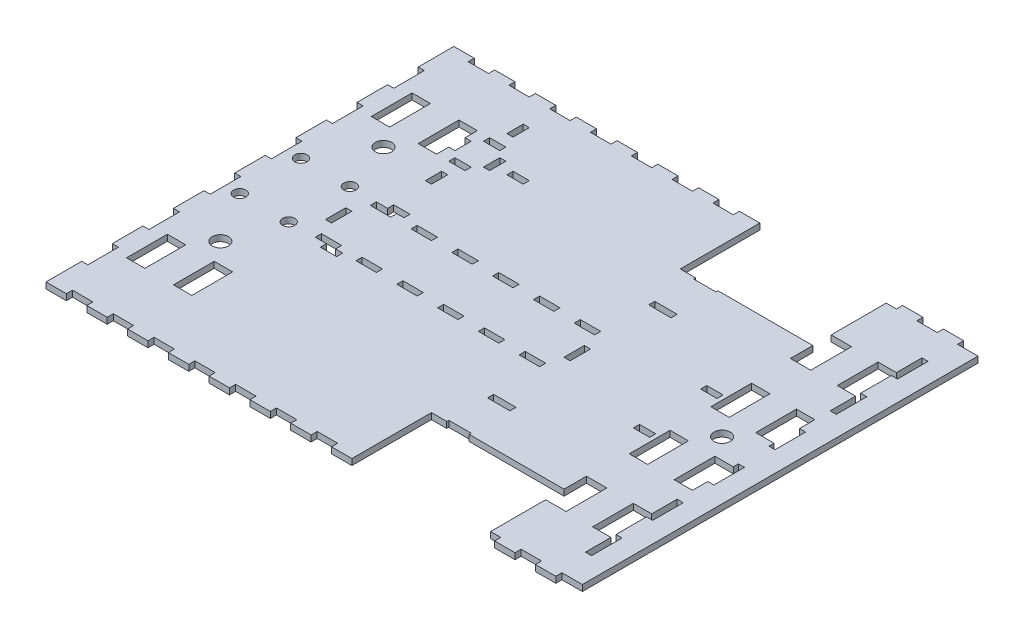
from build123d import *

# Parameters (mm, degrees)
SKETCH3_R             = 3
SKETCH3_W             = 10
SKETCH3_H             = 3
SKETCH3_W_2           = 3
SKETCH3_H_2           = 15
SKETCH3_H_3           = 10
BOSS_EXTRUDE1_DEPTH   = 3
SKETCH5_W             = 11
SKETCH5_H             = 3
CUT_EXTRUDE2_DEPTH    = 10
CROQUIS1_W            = 3
CROQUIS1_H            = 15
CORTAR_EXTRUIR1_DEPTH = 10
CROQUIS2_R            = 4
CROQUIS2_W            = 9
CROQUIS2_H            = 20
CROQUIS2_W_2          = 10
CROQUIS2_W_3          = 8
CROQUIS2_H_2          = 3
CROQUIS2_W_4          = 3
CROQUIS2_H_3          = 8
CORTAR_EXTRUIR2_DEPTH = 10


with BuildPart() as part:
    # Sketch3 → Boss-Extrude1 (new body)
    with BuildSketch(Plane(origin=(0, 0, 0), x_dir=(1, 0, 0), z_dir=(0, 1, 0))):
        Polygon((-300, 97), (-300, -97), (-300, -100), (-290, -100), (-290, -97), (-280, -97), (-280, -100), (-270, -100), (-270, -97), (-260, -97), (-260, -100), (-250, -100), (-250, -97), (-240, -97), (-240, -100), (-230, -100), (-230, -97), (-220, -97), (-220, -100), (-210, -100), (-210, -97), (-200, -97), (-200, -100), (-190, -100), (-190, -97), (-180, -97), (-180, -100), (-170, -100), (-170, -97), (-160, -97), (-160, -100), (-150, -100), (-150, -97), (-140, -97), (-140, -100), (-130, -100), (-130, -97), (-120, -97), (-120, -100), (-110, -100), (-110, -97), (-100, -97), (-100, -100), (-90, -100), (-90, -97), (-80, -97), (-80, -100), (-70, -100), (-70, -97), (-60, -97), (-60, -100), (-50, -100), (-50, -97), (-40, -97), (-40, 97), (-50, 97), (-50, 100), (-60, 100), (-60, 97), (-70, 97), (-70, 100), (-80, 100), (-80, 97), (-90, 97), (-90, 100), (-100, 100), (-100, 97), (-110, 97), (-110, 100), (-120, 100), (-120, 97), (-130, 97), (-130, 100), (-140, 100), (-140, 97), (-150, 97), (-150, 100), (-160, 100), (-160, 97), (-170, 97), (-170, 100), (-180, 100), (-180, 97), (-190, 97), (-190, 100), (-200, 100), (-200, 97), (-210, 97), (-210, 100), (-220, 100), (-220, 97), (-230, 97), (-230, 100), (-240, 100), (-240, 97), (-250, 97), (-250, 100), (-260, 100), (-260, 97), (-270, 97), (-270, 100), (-280, 100), (-280, 97), (-290, 97), (-290, 100), (-300, 100), align=None)
        with Locations((-290, -15)):
            Circle(SKETCH3_R, mode=Mode.SUBTRACT)
        with Locations((-266, -15)):
            Circle(SKETCH3_R, mode=Mode.SUBTRACT)
        with Locations((-248, -13.5)):
            Rectangle(SKETCH3_W, SKETCH3_H, mode=Mode.SUBTRACT)
        Polygon((-255, 5), (-255, 0), (-255, -5), (-258, -5), (-258, 0), (-258, 5), align=None, mode=Mode.SUBTRACT)
        with Locations((-228, -13.5)):
            Rectangle(SKETCH3_W, SKETCH3_H, mode=Mode.SUBTRACT)
        with Locations((-208, -13.5)):
            Rectangle(SKETCH3_W, SKETCH3_H, mode=Mode.SUBTRACT)
        with Locations((-188, -13.5)):
            Rectangle(SKETCH3_W, SKETCH3_H, mode=Mode.SUBTRACT)
        with Locations((-51.5, -75)):
            Rectangle(SKETCH3_W_2, SKETCH3_H_2, mode=Mode.SUBTRACT)
        with Locations((-168, -13.5)):
            Rectangle(SKETCH3_W, SKETCH3_H, mode=Mode.SUBTRACT)
        with Locations((-148, -13.5)):
            Rectangle(SKETCH3_W, SKETCH3_H, mode=Mode.SUBTRACT)
        with Locations((-139.5, 0)):
            Rectangle(SKETCH3_W_2, SKETCH3_H_3, mode=Mode.SUBTRACT)
        with Locations((-51.5, -45)):
            Rectangle(SKETCH3_W_2, SKETCH3_H_2, mode=Mode.SUBTRACT)
        with Locations((-51.5, -15)):
            Rectangle(SKETCH3_W_2, SKETCH3_H_2, mode=Mode.SUBTRACT)
        with Locations((-290, 15)):
            Circle(SKETCH3_R, mode=Mode.SUBTRACT)
        with Locations((-266, 15)):
            Circle(SKETCH3_R, mode=Mode.SUBTRACT)
        with Locations((-248, 13.5)):
            Rectangle(SKETCH3_W, SKETCH3_H, mode=Mode.SUBTRACT)
        with Locations((-228, 13.5)):
            Rectangle(SKETCH3_W, SKETCH3_H, mode=Mode.SUBTRACT)
        with Locations((-208, 13.5)):
            Rectangle(SKETCH3_W, SKETCH3_H, mode=Mode.SUBTRACT)
        with Locations((-188, 13.5)):
            Rectangle(SKETCH3_W, SKETCH3_H, mode=Mode.SUBTRACT)
        with Locations((-168, 13.5)):
            Rectangle(SKETCH3_W, SKETCH3_H, mode=Mode.SUBTRACT)
        with Locations((-148, 13.5)):
            Rectangle(SKETCH3_W, SKETCH3_H, mode=Mode.SUBTRACT)
        with Locations((-51.5, 15)):
            Rectangle(SKETCH3_W_2, SKETCH3_H_2, mode=Mode.SUBTRACT)
        with Locations((-51.5, 45)):
            Rectangle(SKETCH3_W_2, SKETCH3_H_2, mode=Mode.SUBTRACT)
        with Locations((-51.5, 75)):
            Rectangle(SKETCH3_W_2, SKETCH3_H_2, mode=Mode.SUBTRACT)
    extrude(amount=BOSS_EXTRUDE1_DEPTH)

    # Sketch5 → Cut-Extrude2 (cut)
    with BuildSketch(Plane(origin=(0, 3, 0), x_dir=(1, 0, 0), z_dir=(0, 1, 0))):
        with Locations((-137, -39.5)):
            Rectangle(SKETCH5_W, SKETCH5_H)
        Polygon((-131.5, -60), (-142.5, -60), (-142.5, -61), (-150, -61), (-150, -97), (-85, -97), (-85, -61), (-131.5, -61), align=None)
        Polygon((-131.5, 61), (-85, 61), (-85, 97), (-150, 97), (-150, 61), (-142.5, 61), (-142.5, 60), (-131.5, 60), align=None)
        with Locations((-137, 39.5)):
            Rectangle(SKETCH5_W, SKETCH5_H)
    extrude(amount=-CUT_EXTRUDE2_DEPTH, mode=Mode.SUBTRACT)


with BuildPart() as cut_extrude2_kept_piece:
    # of the separate pieces the step leaves, the one the design keeps (cut_extrude2_pieces_kept)
    add(part.part.solids().sort_by_distance((-300, 0, -100))[0])

    # Croquis1 → Cortar-Extruir1 (cut)
    with BuildSketch(Plane(origin=(0, 3, 0), x_dir=(1, 0, 0), z_dir=(0, 1, 0))):
        with Locations((-298.5, -75)):
            Rectangle(CROQUIS1_W, CROQUIS1_H)
        with Locations((-298.5, 45)):
            Rectangle(CROQUIS1_W, CROQUIS1_H)
        with Locations((-298.5, 15)):
            Rectangle(CROQUIS1_W, CROQUIS1_H)
        with Locations((-298.5, -15)):
            Rectangle(CROQUIS1_W, CROQUIS1_H)
        with Locations((-298.5, 75)):
            Rectangle(CROQUIS1_W, CROQUIS1_H)
        with Locations((-298.5, -45)):
            Rectangle(CROQUIS1_W, CROQUIS1_H)
    extrude(amount=-CORTAR_EXTRUIR1_DEPTH, mode=Mode.SUBTRACT)

    # Croquis2 → Cortar-Extruir2 (cut)
    with BuildSketch(Plane(origin=(0, 3, 0), x_dir=(1, 0, 0), z_dir=(0, 1, 0))):
        with Locations((-68.5, 0)):
            Circle(CROQUIS2_R)
        with Locations((-274.5, -40)):
            Circle(CROQUIS2_R)
        with Locations((-274.5, 40)):
            Circle(CROQUIS2_R)
        with Locations((-57.5, -20)):
            Rectangle(CROQUIS2_W, CROQUIS2_H)
        with Locations((-57.5, -60)):
            Rectangle(CROQUIS2_W, CROQUIS2_H)
        with Locations((-57.5, 60)):
            Rectangle(CROQUIS2_W, CROQUIS2_H)
        with Locations((-57.5, 20)):
            Rectangle(CROQUIS2_W, CROQUIS2_H)
        with Locations((-80, 60)):
            Rectangle(CROQUIS2_W_2, CROQUIS2_H)
        with Locations((-79.5, 20)):
            Rectangle(CROQUIS2_W, CROQUIS2_H)
        with Locations((-79.5, -20)):
            Rectangle(CROQUIS2_W, CROQUIS2_H)
        with Locations((-80, -60)):
            Rectangle(CROQUIS2_W_2, CROQUIS2_H)
        Polygon((-243.49, 18), (-247.49, 18), (-247.49, 15), (-239.49, 15), (-239.49, 18), align=None)
        with Locations((-263, -60)):
            Rectangle(CROQUIS2_W, CROQUIS2_H)
        Polygon((-239.49, -18), (-243.49, -18), (-247.49, -18), (-247.49, -15), (-239.49, -15), align=None)
        Polygon((-258.5, 50), (-258.5, 56), (-255.5, 56), (-255.5, 64), (-258.5, 64), (-258.5, 70), (-267.5, 70), (-267.5, 50), align=None)
        with Locations((-90, 16.5)):
            Rectangle(CROQUIS2_W_3, CROQUIS2_H_2)
        with Locations((-286, 60)):
            Rectangle(CROQUIS2_W, CROQUIS2_H)
        with Locations((-286, -60)):
            Rectangle(CROQUIS2_W, CROQUIS2_H)
        with Locations((-90, -16.5)):
            Rectangle(CROQUIS2_W_3, CROQUIS2_H_2)
        Polygon((-250, 40), (-250, 44), (-247, 44), (-247, 36), (-250, 36), align=None)
        Polygon((-252.5, 50), (-244.5, 50), (-244.5, 53), (-248.5, 53), (-252.5, 53), align=None)
        Polygon((-250, 80), (-250, 76), (-247, 76), (-247, 84), (-250, 84), align=None)
        Polygon((-228.5, 61.5), (-232.5, 61.5), (-232.5, 58.5), (-224.5, 58.5), (-224.5, 61.5), align=None)
        with Locations((-240, 60)):
            Rectangle(CROQUIS2_W_4, CROQUIS2_H_3)
        with Locations((-248.5, 68.5)):
            Rectangle(CROQUIS2_W_3, CROQUIS2_H_2)
    extrude(amount=-CORTAR_EXTRUIR2_DEPTH, mode=Mode.SUBTRACT)


solid = cut_extrude2_kept_piece.part
